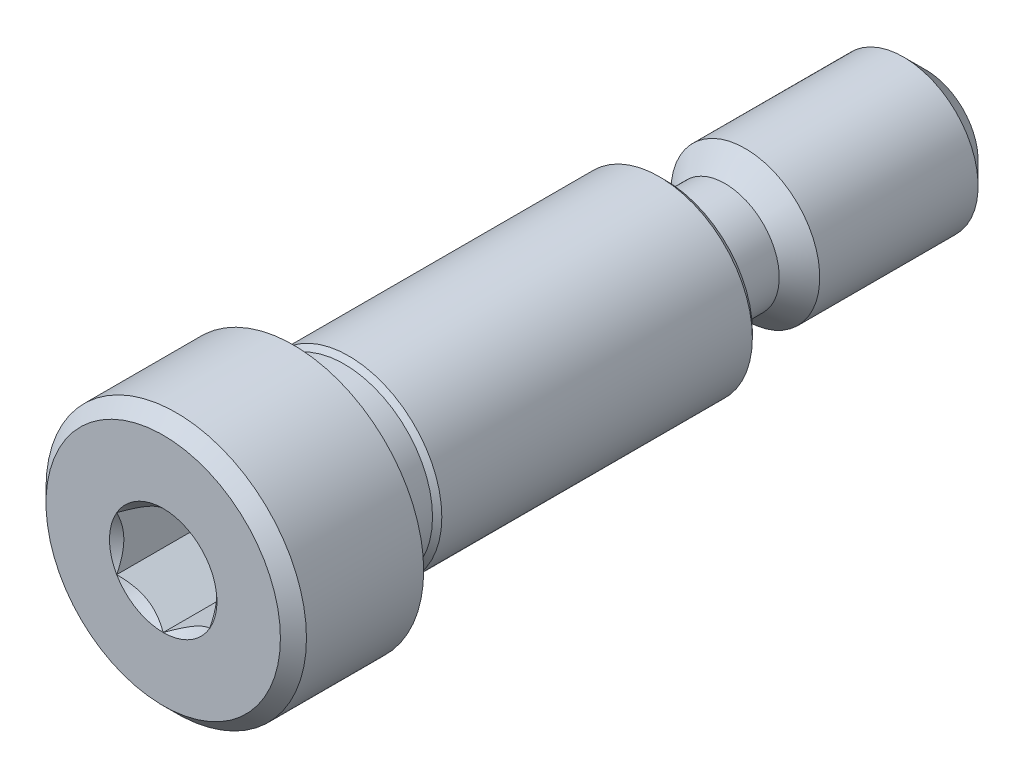
from build123d import *

# Parameters (mm, degrees)
CUT_EXTRUDE1_DEPTH = 4.1671875


with BuildPart() as part:
    # Sketch4 → Revolve1 (revolve)
    with BuildSketch(Plane(origin=(0, 0, 0), x_dir=(0, 0, -1), z_dir=(1, 0, 0))):
        Polygon((-10.715625, 5.55625), (-15.71625, 5.55625), (-16.271875, 5.000625), (-16.271875, 0), (5.159375, 0), (5.159375, 3.704166667), (4.894791667, 3.96875), (-8.353425, 3.96875), (-8.5518625, 3.7703125), (-10.5171875, 3.7703125), (-10.715625, 3.96875), align=None)
    revolve(axis=Axis((0, 0, 16.271875), (0, 0, -1)))

    # Sketch5 → Cut-Extrude1 (cut)
    with BuildSketch(Plane.XY.offset(16.271875)):
        Polygon((1.984375, 1.14567944), (0, 2.291358881), (-1.984375, 1.14567944), (-1.984375, -1.14567944), (0, -2.291358881), (1.984375, -1.14567944), align=None)
    extrude(amount=-CUT_EXTRUDE1_DEPTH, mode=Mode.SUBTRACT)

    # Cut-Extrude4 cone 1 section (through the dimple's axis) → Cut-Extrude4 (revolve, cut)
    with BuildSketch(Plane(origin=(0, 0, 16.271875), x_dir=(0, -1, 0), z_dir=(1, 0, 0))):
        Polygon((0, 0), (2.291358881, 0), (0, 2.291358881), align=None)
    revolve(axis=Axis((0, 0, 16.271875), (0, 0, -1)), mode=Mode.SUBTRACT)

    # Sketch7 → Revolve2 (revolve)
    with BuildSketch(Plane(origin=(0, 0, 0), x_dir=(0, 0, -1), z_dir=(1, 0, 0))):
        Polygon((5.159375, 3.175), (15.319375, 3.175), (16.271875, 2.2225), (16.271875, 0), (5.159375, 0), align=None)
    revolve(axis=Axis((0, 0, -16.271875), (0, 0, 1)))

    # Sketch10 → Cut-Revolve1 (revolve, cut)
    with BuildSketch(Plane(origin=(0, 0, 0), x_dir=(0, 0, -1), z_dir=(1, 0, 0))):
        with BuildLine():
            Line((6.022975, 2.3114), (7.699375, 2.3114))
            Line((7.699375, 2.3114), (9.356725, 3.96875))
            Line((9.356725, 3.96875), (5.159375, 3.96875))
            Line((5.159375, 3.96875), (5.159375, 3.175))
            ThreePointArc((5.159375, 3.175), (5.412317584, 2.564342584), (6.022975, 2.3114))
        make_face()
    revolve(axis=Axis((0, 0, -16.271875), (0, 0, 1)), mode=Mode.SUBTRACT)


solid = part.part
